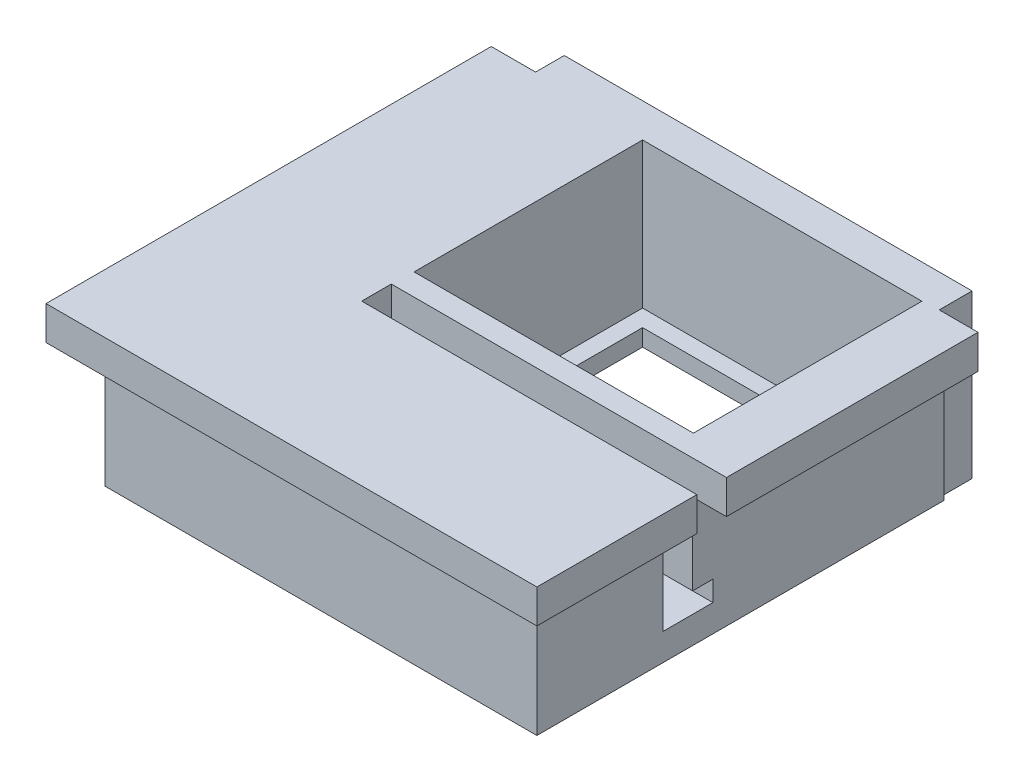
from build123d import *

# Parameters (mm, degrees)
SKETCH4_W                = 25.5
SKETCH4_H                = 26
BOSS_EXTRUDE6_DEPTH      = 9.6
SKETCH17_W               = 1.117177271
SKETCH17_H               = 1.695527899
CUT_EXTRUDE3_DEPTH       = 9.6
SKETCH18_W               = 17.800407573
SKETCH18_H               = 1.75
CUT_EXTRUDE10_DEPTH      = 8
SKETCH20_W               = 16.5
SKETCH20_H               = 13.5
CUT_EXTRUDE13_DEPTH      = 10.5
SKETCH21_W               = 0.291364414
SKETCH21_H               = 1.940061713
CUT_EXTRUDE14_DEPTH      = 10.5
SKETCH22_W               = 14.860187615
SKETCH22_H               = 2.002394184
BOSS_EXTRUDE7_DEPTH      = 2
SKETCH23_W               = 7.449750672
SKETCH23_H               = 1.995003107
BOSS_EXTRUDE8_DEPTH      = 2
SKETCH24_W               = 27.5
SKETCH24_H               = 1.995003107
BOSS_EXTRUDE9_DEPTH      = 2
SKETCH25_W               = 26.3044721
SKETCH25_H               = 1.995003107
BOSS_EXTRUDE10_DEPTH     = 1.5
CUT_EXTRUDE15_DEPTH      = 47.047162057
CUT_EXTRUDE15_DEPTH_BACK = 18.5
SKETCH19_W               = 1.2
SKETCH19_H               = 1.2
SKETCH26_W               = 13.5
SKETCH26_H               = 1
BOSS_EXTRUDE11_DEPTH     = 1
SKETCH27_W               = 15.5
SKETCH27_H               = 1
BOSS_EXTRUDE12_DEPTH     = 1
SKETCH28_W               = 12.5
SKETCH28_H               = 1
BOSS_EXTRUDE13_DEPTH     = 1
SKETCH29_W               = 14.5
SKETCH29_H               = 1
BOSS_EXTRUDE14_DEPTH     = 1


with BuildPart() as part:
    # Sketch4 → Boss-Extrude6 (new body)
    with BuildSketch(Plane(origin=(-9.896990102, 0, -25.516417911), x_dir=(1, 0, 0), z_dir=(0, 1, 0))):
        with Locations((-13.336718814, -2.472262581)):
            Rectangle(SKETCH4_W, SKETCH4_H)
    extrude(amount=BOSS_EXTRUDE6_DEPTH)

    # Sketch17 → Cut-Extrude3 (cut)
    with BuildSketch(Plane(origin=(-9.896990102, 9.6, -25.516417911), x_dir=(1, 0, 0), z_dir=(0, 1, 0))):
        with Locations((-25.528130178, 9.67997347)):
            Rectangle(SKETCH17_W, SKETCH17_H)
    extrude(amount=-CUT_EXTRUDE3_DEPTH, mode=Mode.SUBTRACT)

    # Sketch18 → Cut-Extrude10 (cut)
    with BuildSketch(Plane(origin=(-9.896990102, 9.6, -25.516417911), x_dir=(1, 0, 0), z_dir=(0, 1, 0))):
        with Locations((-9.486922601, -7.147511908)):
            Rectangle(SKETCH18_W, SKETCH18_H)
    extrude(amount=-CUT_EXTRUDE10_DEPTH, mode=Mode.SUBTRACT)

    # Sketch20 → Cut-Extrude13 (cut)
    with BuildSketch(Plane(origin=(0, 9.6, 0), x_dir=(1, 0, 0), z_dir=(0, 1, 0))):
        with Locations((-19.980689098, 27.286418407)):
            Rectangle(SKETCH20_W, SKETCH20_H)
    extrude(amount=-CUT_EXTRUDE13_DEPTH, mode=Mode.SUBTRACT)

    # Sketch21 → Cut-Extrude14 (cut)
    with BuildSketch(Plane(origin=(0, 9.6, 0), x_dir=(1, 0, 0), z_dir=(0, 1, 0))):
        with Locations((-10.629391123, 35.074124474)):
            Rectangle(SKETCH21_W, SKETCH21_H)
    extrude(amount=-CUT_EXTRUDE14_DEPTH, mode=Mode.SUBTRACT)

    # Sketch22 → Boss-Extrude7 (add)
    with BuildSketch(Plane(origin=(-10.483708916, 0, 0), x_dir=(0, 0, -1), z_dir=(1, 0, 0))):
        with Locations((26.67399981, 8.598802908)):
            Rectangle(SKETCH22_W, SKETCH22_H)
    extrude(amount=BOSS_EXTRUDE7_DEPTH)

    # Sketch23 → Boss-Extrude8 (add)
    with BuildSketch(Plane(origin=(-10.483708916, 0, 0), x_dir=(0, 0, -1), z_dir=(1, 0, 0))):
        with Locations((13.769030667, 8.602498447)):
            Rectangle(SKETCH23_W, SKETCH23_H)
    extrude(amount=BOSS_EXTRUDE8_DEPTH)

    # Sketch24 → Boss-Extrude9 (add)
    with BuildSketch(Plane.XY.offset(-10.044155331)):
        with Locations((-22.233708916, 8.602498447)):
            Rectangle(SKETCH24_W, SKETCH24_H)
    extrude(amount=BOSS_EXTRUDE9_DEPTH)

    # Sketch25 → Boss-Extrude10 (add)
    with BuildSketch(Plane.ZY.offset(35.983708916)):
        with Locations((-21.196391381, 8.602498447)):
            Rectangle(SKETCH25_W, SKETCH25_H)
    extrude(amount=BOSS_EXTRUDE10_DEPTH)

    # Sketch19 → Cut-Extrude15 (cut, two sides: drawn at the far end of the back side and taken through both)
    with BuildSketch(Plane(origin=(-10.483708916, 0, 0), x_dir=(0, 0, -1), z_dir=(1, 0, 0)).offset(-CUT_EXTRUDE15_DEPTH_BACK)):
        with Locations((19.843906003, 2.2)):
            Rectangle(SKETCH19_W, SKETCH19_H)
    extrude(amount=CUT_EXTRUDE15_DEPTH + CUT_EXTRUDE15_DEPTH_BACK, mode=Mode.SUBTRACT)

    # Sketch26 → Boss-Extrude11 (add)
    with BuildSketch(Plane(origin=(-28.230689098, 0, 0), x_dir=(0, 0, -1), z_dir=(1, 0, 0))):
        with Locations((27.286418407, 0.5)):
            Rectangle(SKETCH26_W, SKETCH26_H)
    extrude(amount=BOSS_EXTRUDE11_DEPTH)

    # Sketch27 → Boss-Extrude12 (add)
    with BuildSketch(Plane.XY.offset(-34.036418407)):
        with Locations((-19.480689098, 0.5)):
            Rectangle(SKETCH27_W, SKETCH27_H)
    extrude(amount=BOSS_EXTRUDE12_DEPTH)

    # Sketch28 → Boss-Extrude13 (add)
    with BuildSketch(Plane.ZY.offset(11.730689098)):
        with Locations((-26.786418407, 0.5)):
            Rectangle(SKETCH28_W, SKETCH28_H)
    extrude(amount=BOSS_EXTRUDE13_DEPTH)

    # Sketch29 → Boss-Extrude14 (add)
    with BuildSketch(Plane(origin=(0, 0, -20.536418407), x_dir=(-1, 0, 0), z_dir=(0, 0, -1))):
        with Locations((19.980689098, 0.5)):
            Rectangle(SKETCH29_W, SKETCH29_H)
    extrude(amount=BOSS_EXTRUDE14_DEPTH)


solid = part.part
